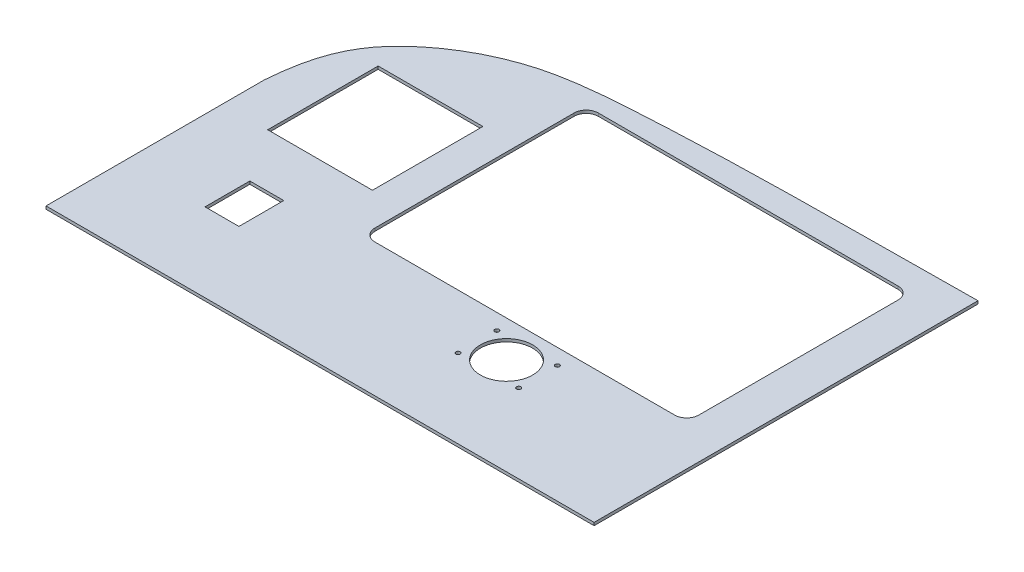
from build123d import *

# Parameters (mm, degrees)
CROQUIS1_R              = 21.6
CROQUIS1_R_2            = 1.75
CROQUIS1_W              = 28
CROQUIS1_H              = 37
CROQUIS1_W_2            = 86.5
CROQUIS1_H_2            = 91.2
SALIENTE_EXTRUIR1_DEPTH = 2.4


with BuildPart() as part:
    # Croquis1 → Saliente-Extruir1 (new body)
    with BuildSketch(Plane(origin=(0, 0, 0), x_dir=(1, 0, 0), z_dir=(0, 1, 0))):
        with BuildLine():
            Line((-226.279027723, 0), (226.279027723, 0))
            Line((226.279027723, 0), (226.279027723, 317))
            add(Edge.make_bspline(
                [(226.279027723, 317), (126.058596011, 315.530489859), (25.957083457, 316.912644391), (-74, 309.175657787)],
                knots=[0, 0, 0, 0, 1, 1, 1, 1], degree=3))
            add(Edge.make_bspline(
                [(-226.279027723, 180), (-223.667205932, 215.476583649), (-213.411911356, 241.728935898), (-180.591001989, 273.897889753), (-156.350341436, 289.269961958), (-113.067752708, 305.04715057), (-89.421541744, 307.637409523), (-74, 309.175657787)],
                knots=[0, 0, 0, 0, 0.358064893, 0.430060637, 0.687746689, 0.747961701, 1, 1, 1, 1], degree=3))
            Line((-226.279027723, 180), (-226.279027723, 0))
        make_face()
        with Locations((73.979027723, 80)):
            Circle(CROQUIS1_R, mode=Mode.SUBTRACT)
        with Locations((48.979027723, 97)):
            Circle(CROQUIS1_R_2, mode=Mode.SUBTRACT)
        with Locations((98.979027723, 97)):
            Circle(CROQUIS1_R_2, mode=Mode.SUBTRACT)
        with Locations((98.979027723, 65)):
            Circle(CROQUIS1_R_2, mode=Mode.SUBTRACT)
        with Locations((48.979027723, 65)):
            Circle(CROQUIS1_R_2, mode=Mode.SUBTRACT)
        with Locations((-145.970972277, 83.5)):
            Rectangle(CROQUIS1_W, CROQUIS1_H, mode=Mode.SUBTRACT)
        with BuildLine():
            Line((-64.720972277, 294.5), (182.779027723, 294.5))
            ThreePointArc((182.779027723, 294.5), (189.850095535, 291.571067812), (192.779027723, 284.5))
            Line((192.779027723, 284.5), (192.779027723, 120))
            ThreePointArc((192.779027723, 120), (189.850095535, 112.928932188), (182.779027723, 110))
            Line((182.779027723, 110), (-64.720972277, 110))
            ThreePointArc((-64.720972277, 110), (-71.792040088, 112.928932188), (-74.720972277, 120))
            Line((-74.720972277, 120), (-74.720972277, 284.5))
            ThreePointArc((-74.720972277, 284.5), (-71.792040088, 291.571067812), (-64.720972277, 294.5))
        make_face(mode=Mode.SUBTRACT)
        with Locations((-145.970972277, 191.6)):
            Rectangle(CROQUIS1_W_2, CROQUIS1_H_2, mode=Mode.SUBTRACT)
    extrude(amount=SALIENTE_EXTRUIR1_DEPTH)


solid = part.part
